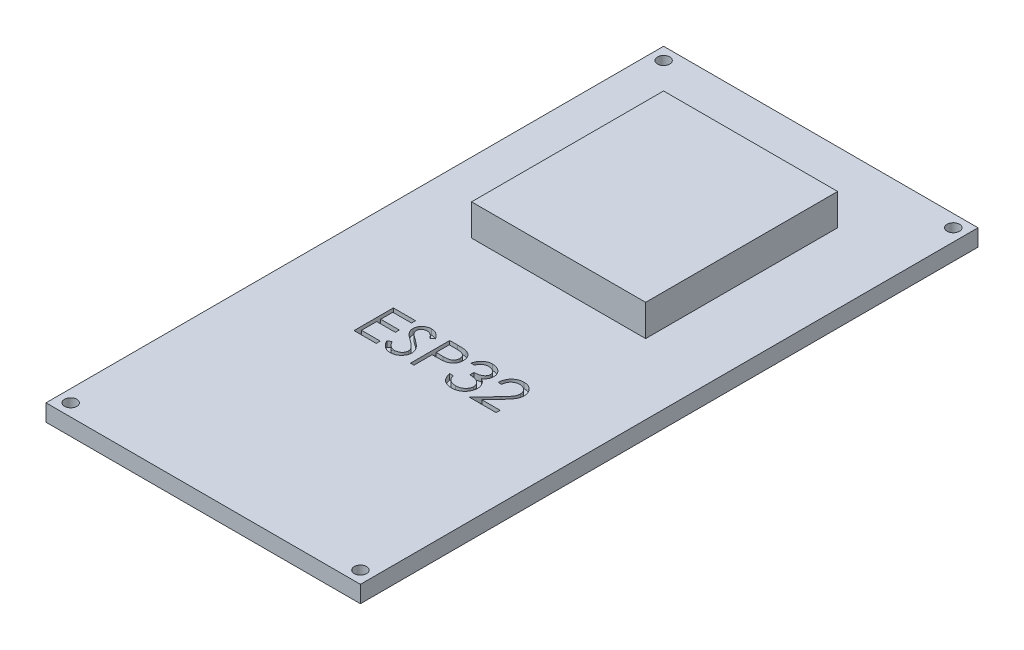
from build123d import *

# Parameters (mm, degrees)
SKETCH2_W                                  = 28
SKETCH2_H                                  = 55
BOSS_EXTRUDE1_DEPTH                        = 1.5
SKETCH3_W                                  = 15.5
SKETCH3_H                                  = 17.1
BOSS_EXTRUDE2_DEPTH                        = 2.8
CUT_EXTRUDE1_DEPTH                         = 0.5
SKETCH5_R                                  = 0.55
CUT_EXTRUDE2_DEPTH                         = 62.780579607
MIRROR2_AT_THE_SECOND_PLANE_COPY_1_SKETC_R = 0.55
MIRROR2_AT_THE_SECOND_PLANE_COPY_1_DEPTH   = 62.780579607


with BuildPart() as part:
    # Sketch2 → Boss-Extrude1 (new body)
    with BuildSketch(Plane(origin=(0, 0, 0), x_dir=(1, 0, 0), z_dir=(0, 1, 0))):
        with Locations((14, 27.5)):
            Rectangle(SKETCH2_W, SKETCH2_H)
    extrude(amount=BOSS_EXTRUDE1_DEPTH)

    # Sketch3 → Boss-Extrude2 (add)
    with BuildSketch(Plane(origin=(0, 1.5, 0), x_dir=(1, 0, 0), z_dir=(0, 1, 0))):
        with Locations((14, 40.2)):
            Rectangle(SKETCH3_W, SKETCH3_H)
    extrude(amount=BOSS_EXTRUDE2_DEPTH)

    # Sketch4 → Cut-Extrude1 (cut)
    # profile 1 of 5: a face of its own
    with BuildSketch(Plane(origin=(0, 1.5, 0), x_dir=(1, 0, 0), z_dir=(0, 1, 0))):
        Polygon((8.14563785, 22.784590523), (10.119996825, 22.784590523), (10.119996825, 22.425616164), (8.459740414, 22.425616164), (8.459740414, 21.348693087), (10.119996825, 21.348693087), (10.119996825, 20.989718728), (8.459740414, 20.989718728), (8.459740414, 19.643564882), (10.119996825, 19.643564882), (10.119996825, 19.284590523), (8.14563785, 19.284590523), align=None)
    # profile 2 of 5: a face of its own
    with BuildSketch(Plane(origin=(0, 1.5, 0), x_dir=(1, 0, 0), z_dir=(0, 1, 0))):
        with BuildLine():
            Line((10.389227594, 19.959770811), (10.685100991, 20.137154625))
            add(Edge.make_bspline(
                [(10.685100991, 20.137154625), (10.712619229, 20.09109024), (10.765343109, 20.002832656), (10.853294468, 19.883574616), (10.944427379, 19.782212459), (11.039416713, 19.699335852), (11.137682661, 19.634086965), (11.239866715, 19.587884733), (11.345624526, 19.559068758), (11.417598347, 19.555568671), (11.453530478, 19.553821292)],
                knots=[0, 0, 0, 0, 1.272034388, 2.437168799, 3.508375237, 4.49857839, 5.41946034, 6.295179144, 7.148887113, 8, 8, 8, 8], degree=3))
            add(Edge.make_bspline(
                [(11.453530478, 19.553821292), (11.484217339, 19.554675964), (11.545054112, 19.556370355), (11.634616355, 19.572651157), (11.721598157, 19.597663286), (11.804206795, 19.633484217), (11.88130241, 19.676822703), (11.948909105, 19.72916888), (12.007355218, 19.787775086), (12.055164333, 19.853157741), (12.091844368, 19.923474889), (12.120036436, 19.995650841), (12.13568151, 20.070819409), (12.138038263, 20.121429872), (12.139227594, 20.14697033)],
                knots=[0, 0, 0, 0, 1.095163259, 2.171163733, 3.241058638, 4.321873601, 5.38011039, 6.391990106, 7.366004449, 8.327778327, 9.272591725, 10.192022065, 11.087607919, 12, 12, 12, 12], degree=3))
            add(Edge.make_bspline(
                [(12.139227594, 20.14697033), (12.137753283, 20.17611118), (12.134756225, 20.235350269), (12.109424745, 20.322749922), (12.069575498, 20.409242492), (12.032812854, 20.462743758), (12.013726793, 20.49052001)],
                knots=[0, 0, 0, 0, 0.938893495, 1.908633276, 2.914225137, 4, 4, 4, 4], degree=3))
            add(Edge.make_bspline(
                [(12.013726793, 20.49052001), (11.998056178, 20.510566833), (11.965157684, 20.552652632), (11.908600172, 20.615297867), (11.842234057, 20.679916286), (11.768330502, 20.748975343), (11.684197413, 20.81926314), (11.592469899, 20.894131418), (11.49080604, 20.970732995), (11.419506543, 21.02210556), (11.382717177, 21.048612958)],
                knots=[0, 0, 0, 0, 0.722233717, 1.516239348, 2.393582979, 3.351407094, 4.387010283, 5.505090956, 6.712668013, 8, 8, 8, 8], degree=3))
            add(Edge.make_bspline(
                [(11.382717177, 21.048612958), (11.345893181, 21.074841546), (11.275488504, 21.124988608), (11.177029922, 21.199412892), (11.088985459, 21.267456762), (11.011746443, 21.329760774), (10.945346846, 21.386333379), (10.889263435, 21.436631318), (10.844924878, 21.482014879), (10.820269297, 21.51145622), (10.809199549, 21.524674657)],
                knots=[0, 0, 0, 0, 1.452282411, 2.77665338, 3.964542531, 5.026858415, 5.96415736, 6.766646006, 7.446254459, 8, 8, 8, 8], degree=3))
            add(Edge.make_bspline(
                [(10.809199549, 21.524674657), (10.793727004, 21.545275694), (10.763298167, 21.585790398), (10.723132162, 21.649115256), (10.688992999, 21.713938521), (10.662230667, 21.780434386), (10.639694448, 21.847669314), (10.624536517, 21.91652056), (10.61504512, 21.986679179), (10.614073134, 22.033892679), (10.613586568, 22.057527221)],
                knots=[0, 0, 0, 0, 1.068054152, 2.10047183, 3.106115577, 4.101338837, 5.06977816, 6.043150881, 7.020423561, 8, 8, 8, 8], degree=3))
            add(Edge.make_bspline(
                [(10.613586568, 22.057527221), (10.614891777, 22.094556996), (10.617474297, 22.16782506), (10.639314815, 22.27485589), (10.673787708, 22.377042307), (10.722082596, 22.473372641), (10.784339949, 22.561338622), (10.856385923, 22.641952109), (10.94219741, 22.709720691), (11.036350033, 22.768932749), (11.139406405, 22.815278675), (11.247397308, 22.850239655), (11.36049438, 22.870048912), (11.437097515, 22.872891677), (11.475966376, 22.874334112)],
                knots=[0, 0, 0, 0, 1.005424448, 1.989358655, 2.955360095, 3.929531133, 4.905563448, 5.876582895, 6.856512386, 7.866279853, 8.892233794, 9.918561126, 10.94386622, 12, 12, 12, 12], degree=3))
            add(Edge.make_bspline(
                [(11.475966376, 22.874334112), (11.517210476, 22.872911561), (11.599231828, 22.87008256), (11.719881044, 22.845485028), (11.83604176, 22.804784356), (11.929485025, 22.758595699), (12.002617786, 22.712464283), (12.058390519, 22.670444459), (12.11490797, 22.62206935), (12.172626025, 22.567210104), (12.230566684, 22.505363353), (12.289590136, 22.436952664), (12.349834405, 22.362396108), (12.388590265, 22.309171607), (12.408458363, 22.281886196)],
                knots=[0, 0, 0, 0, 1.286793592, 2.559021753, 3.825965368, 5.121522368, 5.803751409, 6.523245864, 7.299691795, 8.125521123, 9.008227632, 9.944561021, 10.946284179, 12, 12, 12, 12], degree=3))
            Line((12.408458363, 22.281886196), (12.124504036, 22.066641805))
            add(Edge.make_bspline(
                [(12.124504036, 22.066641805), (12.107358104, 22.088730495), (12.074339047, 22.131268148), (12.02420956, 22.190839464), (11.976960912, 22.245255943), (11.930410512, 22.292521071), (11.887016881, 22.335223205), (11.844899838, 22.371782962), (11.804665487, 22.402558557), (11.753948576, 22.435402117), (11.690230858, 22.467958621), (11.610246322, 22.495507699), (11.526660047, 22.512062761), (11.469730415, 22.514251648), (11.440910286, 22.515359753)],
                knots=[0, 0, 0, 0, 1.181633172, 2.275549214, 3.290209073, 4.226197932, 5.078386478, 5.862611352, 6.581680152, 7.217281963, 8.414376989, 9.595101626, 10.782541182, 12, 12, 12, 12], degree=3))
            add(Edge.make_bspline(
                [(11.440910286, 22.515359753), (11.404753764, 22.514148053), (11.335029316, 22.511811404), (11.23603908, 22.486291419), (11.146945155, 22.446109559), (11.07039259, 22.38979458), (11.006655613, 22.323073588), (10.960550154, 22.246294733), (10.93279999, 22.16151233), (10.92941371, 22.102370674), (10.927689132, 22.072250779)],
                knots=[0, 0, 0, 0, 1.14458467, 2.207223713, 3.21896685, 4.227309161, 5.202851033, 6.127160689, 7.046193047, 8, 8, 8, 8], degree=3))
            add(Edge.make_bspline(
                [(10.927689132, 22.072250779), (10.928082259, 22.0534993), (10.928869155, 22.015965681), (10.939843953, 21.960514259), (10.953943282, 21.90520292), (10.976285913, 21.850280337), (11.007131217, 21.794785978), (11.047636393, 21.73776424), (11.098649705, 21.678712531), (11.137726717, 21.640305158), (11.158358203, 21.620027221)],
                knots=[0, 0, 0, 0, 0.858281714, 1.717966888, 2.583508476, 3.4729293, 4.427298488, 5.488583878, 6.674047936, 8, 8, 8, 8], degree=3))
            add(Edge.make_bspline(
                [(11.158358203, 21.620027221), (11.166019575, 21.613190195), (11.184221242, 21.596946987), (11.217497168, 21.570354706), (11.261439966, 21.537551934), (11.314902168, 21.496964618), (11.378869529, 21.449883156), (11.453349085, 21.396909543), (11.537510618, 21.336324084), (11.597232534, 21.293966544), (11.628810927, 21.271569689)],
                knots=[0, 0, 0, 0, 0.420754252, 0.999615792, 1.744751191, 2.668019286, 3.750313428, 4.999500688, 6.413464383, 8, 8, 8, 8], degree=3))
            add(Edge.make_bspline(
                [(11.628810927, 21.271569689), (11.66679684, 21.24392833), (11.740351297, 21.190404668), (11.845008877, 21.109988988), (11.939902685, 21.031341219), (12.025365888, 20.954963612), (12.102242797, 20.881435519), (12.169680518, 20.809872339), (12.228366198, 20.740786766), (12.291545416, 20.652214191), (12.356103236, 20.543433106), (12.411544743, 20.410154868), (12.446503091, 20.276358547), (12.451074606, 20.186431711), (12.453330158, 20.142062478)],
                knots=[0, 0, 0, 0, 1.163667725, 2.253281268, 3.268753668, 4.215851969, 5.092017293, 5.902905408, 6.650798638, 7.335211899, 8.59617414, 9.77448103, 10.901945474, 12, 12, 12, 12], degree=3))
            add(Edge.make_bspline(
                [(12.453330158, 20.142062478), (12.45267302, 20.110684113), (12.451371505, 20.048536729), (12.436410591, 19.957281652), (12.414490926, 19.868650782), (12.381453692, 19.78373967), (12.341130534, 19.700994907), (12.289964286, 19.622587007), (12.230656601, 19.546780608), (12.162622836, 19.475597117), (12.088176934, 19.410250921), (12.009493239, 19.35212186), (11.926442966, 19.303653536), (11.83947665, 19.264102694), (11.748574313, 19.233169177), (11.653766529, 19.210756307), (11.554897018, 19.197000597), (11.487696536, 19.195572835), (11.453530478, 19.194846933)],
                knots=[0, 0, 0, 0, 0.983748083, 1.948392443, 2.894712957, 3.844097841, 4.80183111, 5.778335162, 6.776009319, 7.81870978, 8.863265674, 9.881300176, 10.883814829, 11.87499822, 12.874611388, 13.892143829, 14.928324115, 16, 16, 16, 16], degree=3))
            add(Edge.make_bspline(
                [(11.453530478, 19.194846933), (11.427095135, 19.195358114), (11.374557375, 19.19637404), (11.296847894, 19.20535532), (11.220708304, 19.218062424), (11.147094022, 19.238236494), (11.075056611, 19.262713471), (11.004909376, 19.292851803), (10.936618322, 19.328969005), (10.869800739, 19.370264029), (10.804626565, 19.418321774), (10.741707097, 19.47429527), (10.678977911, 19.536640775), (10.618290515, 19.607051339), (10.558417371, 19.684389422), (10.500538961, 19.769378605), (10.443457244, 19.861555959), (10.407641776, 19.926421045), (10.389227594, 19.959770811)],
                knots=[0, 0, 0, 0, 0.915332311, 1.819136955, 2.706846663, 3.586547465, 4.459518054, 5.340707479, 6.227863349, 7.133153174, 8.059268498, 9.028702269, 10.047606654, 11.120612155, 12.245963614, 13.433783089, 14.680604001, 16, 16, 16, 16], degree=3))
        make_face()
    # profile 3 of 5: a face of its own
    with BuildSketch(Plane(origin=(0, 1.5, 0), x_dir=(1, 0, 0), z_dir=(0, 1, 0))):
        with BuildLine():
            Line((13.171278876, 22.784590523), (13.857677113, 22.784590523))
            add(Edge.make_bspline(
                [(13.857677113, 22.784590523), (13.904888019, 22.784538626), (13.995346212, 22.784439191), (14.125061268, 22.781424445), (14.242870999, 22.777397753), (14.34852138, 22.77181586), (14.442337478, 22.765219269), (14.523894778, 22.75596723), (14.593834334, 22.746306935), (14.635740784, 22.736485528), (14.654852594, 22.732006388)],
                knots=[0, 0, 0, 0, 1.415646017, 2.712440637, 3.8905458, 4.950247383, 5.884950622, 6.709939814, 7.411656543, 8, 8, 8, 8], degree=3))
            add(Edge.make_bspline(
                [(14.654852594, 22.732006388), (14.679046128, 22.725384438), (14.726863105, 22.712296576), (14.795764148, 22.686082853), (14.861317993, 22.655000688), (14.923749552, 22.619576748), (14.982291635, 22.578291184), (15.037817676, 22.532817566), (15.089837656, 22.482105997), (15.138059048, 22.426725258), (15.182343846, 22.367605048), (15.220473528, 22.303862818), (15.252400755, 22.236571514), (15.279784027, 22.165777943), (15.299492481, 22.09088762), (15.314339381, 22.012420907), (15.323763009, 21.930386217), (15.32466557, 21.87432635), (15.32512503, 21.845788439)],
                knots=[0, 0, 0, 0, 0.999701418, 1.975846123, 2.934577507, 3.890451536, 4.834027766, 5.787354733, 6.749476667, 7.726910423, 8.712836071, 9.690891519, 10.682875813, 11.679750201, 12.712814741, 13.765529915, 14.8625177, 16, 16, 16, 16], degree=3))
            add(Edge.make_bspline(
                [(15.32512503, 21.845788439), (15.324703605, 21.817010662), (15.323879059, 21.760704998), (15.313982774, 21.67833221), (15.300652582, 21.59961382), (15.28015553, 21.52472437), (15.253309857, 21.454108599), (15.221817804, 21.386687367), (15.183834273, 21.323607695), (15.140189444, 21.264640578), (15.091637849, 21.209730665), (15.038384911, 21.159275871), (14.980645619, 21.113571533), (14.918603471, 21.072515189), (14.851653622, 21.037058909), (14.780811468, 21.005301604), (14.705461252, 20.978630544), (14.653318738, 20.964600482), (14.626807722, 20.957467125)],
                knots=[0, 0, 0, 0, 1.121902311, 2.195077645, 3.232258892, 4.234102512, 5.217864754, 6.176164875, 7.132989551, 8.084763148, 9.034132444, 9.988522005, 10.94243251, 11.903244335, 12.886203696, 13.894208494, 14.929344452, 16, 16, 16, 16], degree=3))
            add(Edge.make_bspline(
                [(14.626807722, 20.957467125), (14.604880388, 20.952804144), (14.556825361, 20.94258495), (14.477682639, 20.931176493), (14.385537253, 20.921438892), (14.280514973, 20.914137755), (14.162710068, 20.907887386), (14.03205881, 20.902919292), (13.888304733, 20.900189439), (13.788033489, 20.900048646), (13.735681921, 20.899975138)],
                knots=[0, 0, 0, 0, 0.601384939, 1.31797006, 2.144135048, 3.087295005, 4.142315834, 5.309527816, 6.595305764, 8, 8, 8, 8], degree=3))
            Line((13.735681921, 20.899975138), (13.48538144, 20.899975138))
            Line((13.48538144, 20.899975138), (13.48538144, 19.284590523))
            Line((13.48538144, 19.284590523), (13.171278876, 19.284590523))
            Line((13.171278876, 19.284590523), (13.171278876, 22.784590523))
        make_face()
        with BuildLine():
            Line((13.48538144, 22.425616164), (13.48538144, 21.258949497))
            Line((13.48538144, 21.258949497), (14.098161889, 21.251237157))
            add(Edge.make_bspline(
                [(14.098161889, 21.251237157), (14.128081815, 21.251221694), (14.185841614, 21.251191841), (14.269277838, 21.255177065), (14.346687125, 21.259777598), (14.4178317, 21.266513521), (14.482743635, 21.276034779), (14.541531164, 21.285646516), (14.593738447, 21.299551879), (14.654837648, 21.318274948), (14.722920996, 21.350207564), (14.796988544, 21.396557454), (14.859759131, 21.455638162), (14.914077428, 21.522065993), (14.957183305, 21.595965123), (14.988739298, 21.67503406), (15.007280455, 21.758461909), (15.009766649, 21.815550048), (15.011022466, 21.844386196)],
                knots=[0, 0, 0, 0, 1.160613943, 2.240541288, 3.23993089, 4.169200891, 5.011653406, 5.7853311, 6.478053781, 7.106038997, 8.262395093, 9.384106736, 10.481365981, 11.59014053, 12.70357646, 13.786202915, 14.881775077, 16, 16, 16, 16], degree=3))
            add(Edge.make_bspline(
                [(15.011022466, 21.844386196), (15.009759819, 21.872524709), (15.007249834, 21.928460591), (14.988593971, 22.010439352), (14.957244657, 22.088675056), (14.913788063, 22.161648142), (14.861046933, 22.227836946), (14.79974759, 22.285334073), (14.730034328, 22.331555775), (14.665186097, 22.361389057), (14.607584911, 22.379604332), (14.557552951, 22.392349173), (14.501062277, 22.402524779), (14.438094497, 22.410764282), (14.369137663, 22.417817743), (14.293599349, 22.42260372), (14.211765705, 22.425405177), (14.154955134, 22.425544132), (14.125505639, 22.425616164)],
                knots=[0, 0, 0, 0, 1.120700087, 2.227813068, 3.331159281, 4.466773991, 5.599788987, 6.693661531, 7.80175334, 8.91857717, 9.525282508, 10.207424825, 10.974604443, 11.810962634, 12.737642355, 13.736264703, 14.826523623, 16, 16, 16, 16], degree=3))
            Line((14.125505639, 22.425616164), (13.48538144, 22.425616164))
        make_face(mode=Mode.SUBTRACT)
    # profile 4 of 5: a face of its own
    with BuildSketch(Plane(origin=(0, 1.5, 0), x_dir=(1, 0, 0), z_dir=(0, 1, 0))):
        with BuildLine():
            Line((16.177689132, 21.976898215), (15.863586568, 21.976898215))
            add(Edge.make_bspline(
                [(15.863586568, 21.976898215), (15.872096119, 22.012130699), (15.888731594, 22.081007323), (15.923429168, 22.179414584), (15.961228423, 22.272538105), (16.006617528, 22.358634179), (16.056126282, 22.439433082), (16.112849003, 22.513102206), (16.174168726, 22.581515172), (16.241993675, 22.642228409), (16.313122337, 22.697206139), (16.388556957, 22.744081196), (16.46677985, 22.784405349), (16.548332983, 22.817625581), (16.633459155, 22.842651104), (16.721388778, 22.86080791), (16.812352278, 22.872599024), (16.874099869, 22.873749787), (16.905453555, 22.874334112)],
                knots=[0, 0, 0, 0, 1.162005537, 2.271625781, 3.343758855, 4.383309926, 5.390229558, 6.379919256, 7.361854164, 8.333198761, 9.295911338, 10.242430842, 11.177959212, 12.116337295, 13.062827104, 14.020064771, 14.994644689, 16, 16, 16, 16], degree=3))
            add(Edge.make_bspline(
                [(16.905453555, 22.874334112), (16.951136297, 22.872954882), (17.041505308, 22.870226507), (17.174268355, 22.84531207), (17.302295174, 22.805886938), (17.424184422, 22.751413211), (17.537402855, 22.684225897), (17.638139042, 22.604261161), (17.725027552, 22.513061859), (17.79792193, 22.412329295), (17.854996929, 22.304673785), (17.897083303, 22.193873628), (17.922704984, 22.080191657), (17.92602554, 22.003434378), (17.927689132, 21.964979144)],
                knots=[0, 0, 0, 0, 1.083050992, 2.142477498, 3.193116406, 4.255571735, 5.30263384, 6.308962982, 7.297363603, 8.282367274, 9.249857812, 10.179914175, 11.08814088, 12, 12, 12, 12], degree=3))
            add(Edge.make_bspline(
                [(17.927689132, 21.964979144), (17.926525541, 21.92797235), (17.924248574, 21.855555795), (17.904914869, 21.749834298), (17.872378606, 21.650192698), (17.827308843, 21.556211536), (17.768967293, 21.468486696), (17.698294596, 21.386820805), (17.614791934, 21.310851647), (17.551512996, 21.267332174), (17.518935126, 21.244927061)],
                knots=[0, 0, 0, 0, 1.024540389, 2.004866551, 2.965041327, 3.920577974, 4.882998113, 5.874504559, 6.905732034, 8, 8, 8, 8], degree=3))
            add(Edge.make_bspline(
                [(17.518935126, 21.244927061), (17.55616688, 21.226948889), (17.629933755, 21.191328932), (17.730484284, 21.121473174), (17.82176216, 21.040816827), (17.872665879, 20.977874174), (17.898242017, 20.946249176)],
                knots=[0, 0, 0, 0, 1.015518401, 2.012035669, 3.001164323, 4, 4, 4, 4], degree=3))
            add(Edge.make_bspline(
                [(17.898242017, 20.946249176), (17.915083359, 20.923191425), (17.948490255, 20.877453508), (17.989725789, 20.803917082), (18.027134903, 20.729565593), (18.056285123, 20.652406187), (18.07885899, 20.573333173), (18.094995022, 20.492210777), (18.105019163, 20.408972755), (18.106454715, 20.352660275), (18.107176312, 20.324354144)],
                knots=[0, 0, 0, 0, 1.025084078, 2.033381695, 3.024893161, 4.013698104, 4.991890475, 5.976764909, 6.982997093, 8, 8, 8, 8], degree=3))
            add(Edge.make_bspline(
                [(18.107176312, 20.324354144), (18.105381798, 20.275344423), (18.101801216, 20.177555621), (18.069797142, 20.0330809), (18.020183901, 19.891855397), (17.949726965, 19.756780558), (17.863859456, 19.630400177), (17.761702132, 19.517323868), (17.644415724, 19.420125264), (17.513610075, 19.338915036), (17.371892947, 19.273997114), (17.220317355, 19.228939671), (17.061067301, 19.199593671), (16.951860003, 19.196446802), (16.896338972, 19.194846933)],
                knots=[0, 0, 0, 0, 0.955779014, 1.907060117, 2.875433937, 3.871313158, 4.872415639, 5.851225146, 6.836215519, 7.83643374, 8.849228613, 9.86973379, 10.916971861, 12, 12, 12, 12], degree=3))
            add(Edge.make_bspline(
                [(16.896338972, 19.194846933), (16.858919672, 19.195715146), (16.785290967, 19.1974235), (16.677047468, 19.209102101), (16.573725769, 19.230432107), (16.475186171, 19.259135412), (16.381341135, 19.295527154), (16.29247703, 19.340845852), (16.208047136, 19.394157354), (16.128848185, 19.456090942), (16.054889617, 19.525372282), (15.988136893, 19.603231292), (15.9274771, 19.688228696), (15.874534461, 19.781351752), (15.826897509, 19.881397009), (15.787716552, 19.989645508), (15.753230983, 20.105129529), (15.737197519, 20.18560727), (15.728971184, 20.226898215)],
                knots=[0, 0, 0, 0, 1.048658725, 2.063410685, 3.046034179, 4.001477787, 4.936774919, 5.862367409, 6.792675028, 7.730719943, 8.675894397, 9.627829632, 10.600096036, 11.597688215, 12.626045268, 13.701542398, 14.82072376, 16, 16, 16, 16], degree=3))
            Line((15.728971184, 20.226898215), (16.043073748, 20.226898215))
            add(Edge.make_bspline(
                [(16.043073748, 20.226898215), (16.051257039, 20.199949202), (16.067174252, 20.14753103), (16.09426855, 20.072090724), (16.125136822, 20.002932671), (16.158251381, 19.939549549), (16.193029827, 19.881317147), (16.231944752, 19.829775278), (16.272113897, 19.782660075), (16.30239325, 19.756115463), (16.317212369, 19.743124176)],
                knots=[0, 0, 0, 0, 1.198163088, 2.33053128, 3.407730985, 4.417276592, 5.372219308, 6.28897303, 7.162600585, 8, 8, 8, 8], degree=3))
            add(Edge.make_bspline(
                [(16.317212369, 19.743124176), (16.336808946, 19.728015843), (16.375941609, 19.697845811), (16.43970984, 19.659344182), (16.506774726, 19.625983157), (16.5785894, 19.600499461), (16.653604171, 19.5789218), (16.733031536, 19.564801281), (16.816170753, 19.55511311), (16.872938517, 19.554258178), (16.901947946, 19.553821292)],
                knots=[0, 0, 0, 0, 0.946170439, 1.889420265, 2.845303464, 3.807233317, 4.801018734, 5.828864929, 6.890507805, 8, 8, 8, 8], degree=3))
            add(Edge.make_bspline(
                [(16.901947946, 19.553821292), (16.934701449, 19.554437197), (16.998748096, 19.555641547), (17.092202955, 19.566717253), (17.181110403, 19.582847667), (17.264483329, 19.60776065), (17.343413836, 19.638541501), (17.416795486, 19.677189907), (17.485591592, 19.722534628), (17.548920997, 19.774073787), (17.605866505, 19.830495282), (17.656006018, 19.889508353), (17.698630679, 19.950864183), (17.733014258, 20.014902303), (17.760164808, 20.081357532), (17.778648009, 20.150416362), (17.791499524, 20.221513628), (17.792546136, 20.269842597), (17.793073748, 20.294205907)],
                knots=[0, 0, 0, 0, 1.217147791, 2.380027433, 3.494444702, 4.572153297, 5.609568379, 6.639424714, 7.649109417, 8.668170816, 9.669597737, 10.625200337, 11.543417969, 12.441394052, 13.322311151, 14.205496177, 15.095365482, 16, 16, 16, 16], degree=3))
            add(Edge.make_bspline(
                [(17.793073748, 20.294205907), (17.791543446, 20.326817246), (17.788490458, 20.391877654), (17.765181878, 20.487595229), (17.726843014, 20.579818641), (17.673170503, 20.666974431), (17.607834774, 20.747750333), (17.531469867, 20.819821815), (17.443441639, 20.879291906), (17.36242177, 20.920380563), (17.290656613, 20.948417638), (17.229241229, 20.967092602), (17.160484625, 20.982906258), (17.085218277, 20.997618529), (17.00287506, 21.010139878), (16.913544622, 21.020581693), (16.817208861, 21.028936734), (16.750517695, 21.03266783), (16.716150671, 21.034590523)],
                knots=[0, 0, 0, 0, 1.07054697, 2.135767047, 3.216561865, 4.33974944, 5.486079747, 6.621378074, 7.775625952, 8.963672916, 9.598146892, 10.304877434, 11.070270905, 11.915000392, 12.823868403, 13.805723172, 14.86925407, 16, 16, 16, 16], degree=3))
            Line((16.716150671, 21.034590523), (16.716150671, 21.393564882))
            add(Edge.make_bspline(
                [(16.716150671, 21.393564882), (16.759451836, 21.394299685), (16.844268183, 21.395738985), (16.968162488, 21.413146996), (17.0866358, 21.437227624), (17.197062542, 21.474112816), (17.297711255, 21.516953113), (17.385030857, 21.566805322), (17.457798005, 21.622220072), (17.515659076, 21.684052681), (17.559188305, 21.750367728), (17.591015102, 21.819484386), (17.609815428, 21.892008447), (17.612325095, 21.941503115), (17.613586568, 21.966381388)],
                knots=[0, 0, 0, 0, 1.321986639, 2.589447074, 3.816329219, 5.01088745, 6.139805852, 7.153945165, 8.075214402, 8.924034688, 9.728124013, 10.488707548, 11.240355623, 12, 12, 12, 12], degree=3))
            add(Edge.make_bspline(
                [(17.613586568, 21.966381388), (17.613172157, 21.984659133), (17.612347706, 22.02102184), (17.601950429, 22.074146909), (17.586326388, 22.125647855), (17.564846658, 22.175305665), (17.53609646, 22.222775939), (17.501690473, 22.268463388), (17.460722373, 22.312107167), (17.413776926, 22.352787486), (17.363365121, 22.391556724), (17.308115346, 22.424470361), (17.249693471, 22.452615423), (17.188034816, 22.475824925), (17.122939286, 22.493284213), (17.054712728, 22.505820054), (16.983225045, 22.513657709), (16.934453313, 22.514786125), (16.909660286, 22.515359753)],
                knots=[0, 0, 0, 0, 0.884392785, 1.759457502, 2.611959086, 3.489218968, 4.37281399, 5.2945488, 6.255912374, 7.266815255, 8.301784654, 9.332968512, 10.37626691, 11.440494194, 12.520033166, 13.637162961, 14.798855837, 16, 16, 16, 16], degree=3))
            add(Edge.make_bspline(
                [(16.909660286, 22.515359753), (16.869808618, 22.513968391), (16.791969042, 22.511250738), (16.679754125, 22.487447724), (16.575434791, 22.449469641), (16.495696124, 22.404136621), (16.43681355, 22.359386187), (16.394736612, 22.320303801), (16.353416102, 22.276870977), (16.315570425, 22.226412602), (16.277296448, 22.172345812), (16.242451886, 22.11192213), (16.208592194, 22.046717736), (16.188189645, 22.000622102), (16.177689132, 21.976898215)],
                knots=[0, 0, 0, 0, 1.472543308, 2.876219568, 4.221790263, 5.565193594, 6.249813518, 6.953379497, 7.687249741, 8.463570142, 9.283606569, 10.136032583, 11.040678096, 12, 12, 12, 12], degree=3))
        make_face()
    # profile 5 of 5: a face of its own
    with BuildSketch(Plane(origin=(0, 1.5, 0), x_dir=(1, 0, 0), z_dir=(0, 1, 0))):
        with BuildLine():
            Line((18.869996825, 21.707667446), (18.555894261, 21.707667446))
            add(Edge.make_bspline(
                [(18.555894261, 21.707667446), (18.557941414, 21.749338333), (18.561961968, 21.831178848), (18.580790257, 21.950502754), (18.607731134, 22.064557553), (18.645822588, 22.172427467), (18.693128866, 22.275066274), (18.749858893, 22.37206629), (18.817052744, 22.463057479), (18.893259478, 22.547196322), (18.976028117, 22.624383893), (19.065334056, 22.691039136), (19.159179084, 22.747356807), (19.257278483, 22.794438049), (19.360739046, 22.829777895), (19.468621904, 22.855999534), (19.58140104, 22.87177588), (19.658241062, 22.873471666), (19.697320543, 22.874334112)],
                knots=[0, 0, 0, 0, 1.10065271, 2.161652631, 3.183658789, 4.190468796, 5.17591951, 6.163126047, 7.15150782, 8.156236427, 9.156009102, 10.134482811, 11.092018607, 12.041330605, 13.001268258, 13.972401359, 14.968799086, 16, 16, 16, 16], degree=3))
            add(Edge.make_bspline(
                [(19.697320543, 22.874334112), (19.735698617, 22.873435656), (19.811110161, 22.871670221), (19.921172176, 22.856509192), (20.02594947, 22.8327636), (20.125237237, 22.799448184), (20.218243301, 22.754663756), (20.305666346, 22.700866218), (20.388547157, 22.638646386), (20.46315394, 22.565392573), (20.53166202, 22.487190188), (20.590764275, 22.403702285), (20.641377438, 22.317472999), (20.683565118, 22.227844798), (20.714621257, 22.133973769), (20.738199465, 22.037226566), (20.751526879, 21.936601755), (20.753572302, 21.8684952), (20.754612209, 21.833869369)],
                knots=[0, 0, 0, 0, 1.111607364, 2.184268762, 3.212621178, 4.221274766, 5.211760367, 6.196651075, 7.1921475, 8.207485113, 9.220403448, 10.201281604, 11.166441695, 12.114753415, 13.065576456, 14.026450734, 14.996634279, 16, 16, 16, 16], degree=3))
            add(Edge.make_bspline(
                [(20.754612209, 21.833869369), (20.752925564, 21.785119559), (20.749581873, 21.688475431), (20.72072617, 21.546271074), (20.676144073, 21.408366014), (20.622071044, 21.297386962), (20.567450476, 21.208410069), (20.51927068, 21.134494428), (20.461618328, 21.055668011), (20.395020914, 20.971136902), (20.320483108, 20.880642533), (20.23746844, 20.784147766), (20.14534275, 20.682677461), (20.080684568, 20.613371648), (20.047180318, 20.577459112)],
                knots=[0, 0, 0, 0, 1.184203166, 2.347625244, 3.513805382, 4.700623107, 5.337941753, 6.051866363, 6.845199593, 7.711357327, 8.668078039, 9.695487809, 10.805859518, 12, 12, 12, 12], degree=3))
            Line((20.047180318, 20.577459112), (19.171479196, 19.643564882))
            Line((19.171479196, 19.643564882), (20.799484004, 19.643564882))
            Line((20.799484004, 19.643564882), (20.799484004, 19.284590523))
            Line((20.799484004, 19.284590523), (18.421278876, 19.284590523))
            Line((18.421278876, 19.284590523), (19.778650671, 20.733108151))
            add(Edge.make_bspline(
                [(19.778650671, 20.733108151), (19.811698558, 20.767606457), (19.875176785, 20.833870644), (19.964959362, 20.930613604), (20.04559835, 21.020363145), (20.117615743, 21.102949693), (20.179449248, 21.179581261), (20.23432148, 21.247775965), (20.278287071, 21.310530415), (20.326002467, 21.383271029), (20.372216448, 21.472083346), (20.411928804, 21.580617035), (20.436143652, 21.692344288), (20.439048488, 21.767846325), (20.440509645, 21.805824497)],
                knots=[0, 0, 0, 0, 1.329631726, 2.553950428, 3.673215718, 4.687767853, 5.603093632, 6.413772471, 7.123043292, 7.734684054, 8.834405432, 9.900288307, 10.943827018, 12, 12, 12, 12], degree=3))
            add(Edge.make_bspline(
                [(20.440509645, 21.805824497), (20.439873903, 21.829705895), (20.438620977, 21.876771546), (20.427563279, 21.945777305), (20.410852773, 22.012342119), (20.386907515, 22.076670738), (20.355300775, 22.13811639), (20.316827395, 22.19675387), (20.272437332, 22.253442835), (20.221086062, 22.306596133), (20.164674543, 22.355277339), (20.105080293, 22.398401424), (20.042030189, 22.434440535), (19.975790067, 22.463984032), (19.906544597, 22.487159413), (19.834159852, 22.503217993), (19.758835836, 22.513300477), (19.70740234, 22.514664649), (19.681194741, 22.515359753)],
                knots=[0, 0, 0, 0, 0.991446411, 1.95395049, 2.89581595, 3.838931463, 4.798493298, 5.75982156, 6.748411868, 7.785213223, 8.824556874, 9.840280684, 10.836137867, 11.835679398, 12.848801643, 13.863922112, 14.911575587, 16, 16, 16, 16], degree=3))
            add(Edge.make_bspline(
                [(19.681194741, 22.515359753), (19.653823909, 22.514644721), (19.600072112, 22.513240516), (19.521153079, 22.503417852), (19.445867302, 22.486472011), (19.374025399, 22.463295337), (19.305505813, 22.433836788), (19.240641769, 22.397145043), (19.17957888, 22.35336155), (19.122202356, 22.303720994), (19.069338377, 22.248453393), (19.022891502, 22.18684343), (18.982307487, 22.120016014), (18.946898254, 22.048151464), (18.918142564, 21.970597684), (18.896169413, 21.887629979), (18.878782567, 21.799608598), (18.872974046, 21.738823513), (18.869996825, 21.707667446)],
                knots=[0, 0, 0, 0, 1.031018746, 2.02475058, 2.990194455, 3.934040569, 4.864654155, 5.795059489, 6.735614925, 7.690564532, 8.649604399, 9.611025574, 10.590972636, 11.591080095, 12.624614302, 13.701020113, 14.821632451, 16, 16, 16, 16], degree=3))
        make_face()
    extrude(amount=-CUT_EXTRUDE1_DEPTH, mode=Mode.SUBTRACT)

    # Sketch5 → Cut-Extrude2 (cut, through all)
    with BuildSketch(Plane(origin=(0, 1.5, 0), x_dir=(1, 0, 0), z_dir=(0, 1, 0))):
        with Locations((1.1, 53.9)):
            Circle(SKETCH5_R)
    cut_extrude2 = extrude(amount=-CUT_EXTRUDE2_DEPTH, mode=Mode.SUBTRACT)

    # Mirror2: Cut-Extrude2 across plane
    add(cut_extrude2.mirror(Plane(origin=(14, 0, 0), x_dir=(0, 0, 1), z_dir=(1, 0, 0))), mode=Mode.SUBTRACT)

    # Mirror2 at the second plane: Cut-Extrude2 across plane
    add(cut_extrude2.mirror(Plane(origin=(0, 0, -27.5), x_dir=(1, 0, 0), z_dir=(0, 0, -1))), mode=Mode.SUBTRACT)

    # Mirror2 at the second plane copy 1 sketc → Mirror2 at the second plane copy 1 (cut, through all)
    with BuildSketch(Plane(origin=(28, 1.5, -55), x_dir=(-1, 0, 0), z_dir=(0, 1, 0))):
        with Locations((1.1, 53.9)):
            Circle(MIRROR2_AT_THE_SECOND_PLANE_COPY_1_SKETC_R)
    extrude(amount=-MIRROR2_AT_THE_SECOND_PLANE_COPY_1_DEPTH, mode=Mode.SUBTRACT)


solid = part.part
